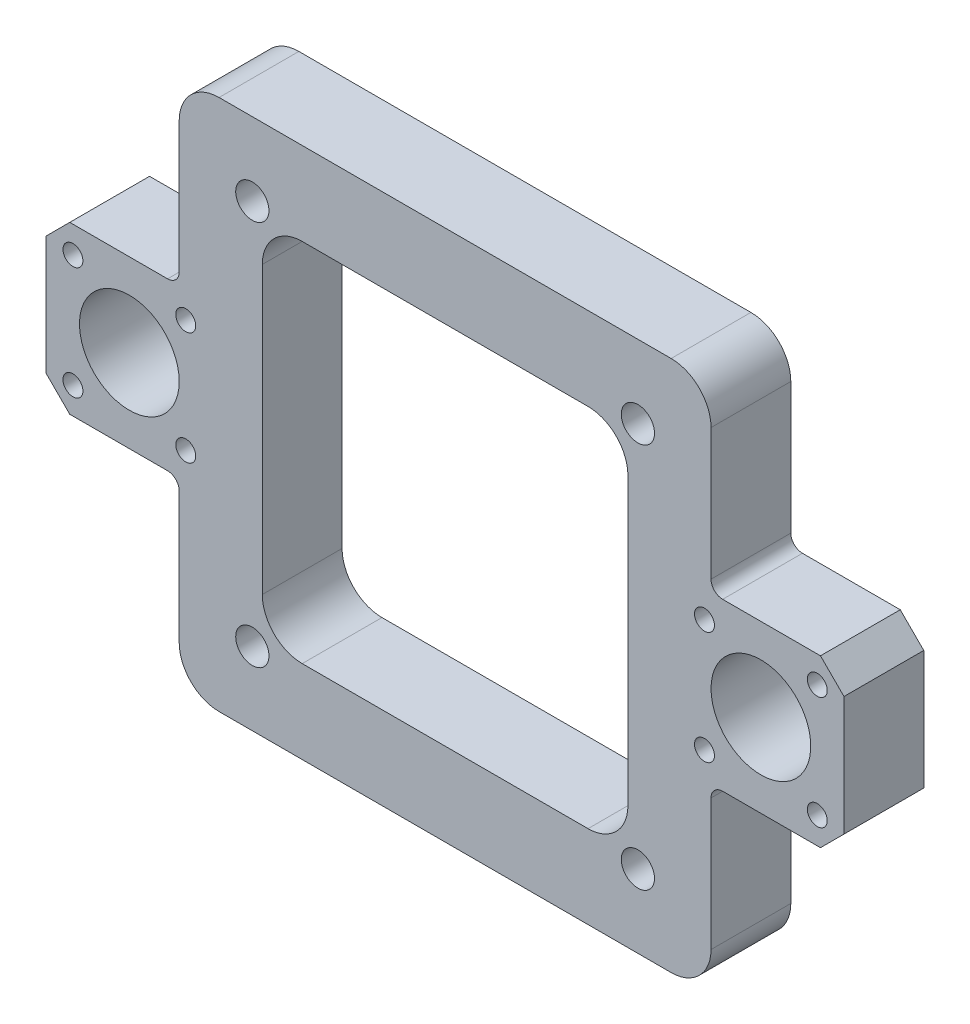
from build123d import *

# Parameters (mm, degrees)
SKETCH1_R               = 7.5
SKETCH1_R_2             = 1.5
SKETCH1_R_3             = 2.5
BOSS_EXTRUDE1_DEPTH     = 12
CUT_EXTRUDE1_DEPTH      = 74.10266753
CUT_EXTRUDE1_DEPTH_BACK = 74.10266753


with BuildPart() as part:
    # Sketch1 → Boss-Extrude1 (new body)
    with BuildSketch(Plane.XY):
        with BuildLine():
            Line((-56.464466094, 12.5), (-41.75, 12.5))
            ThreePointArc((-41.75, 12.5), (-40.512563133, 13.012563133), (-40, 14.25))
            Line((-40, 14.25), (-40, 34))
            ThreePointArc((-40, 34), (-38.242640687, 38.242640687), (-34, 40))
            Line((-34, 40), (34, 40))
            ThreePointArc((34, 40), (38.242640687, 38.242640687), (40, 34))
            Line((40, 34), (40, 14.25))
            ThreePointArc((40, 14.25), (40.512563133, 13.012563133), (41.75, 12.5))
            Line((41.75, 12.5), (56.464466094, 12.5))
            Line((56.464466094, 12.5), (60, 8.964466094))
            Line((60, 8.964466094), (60, -8.964466094))
            Line((60, -8.964466094), (56.464466094, -12.5))
            Line((56.464466094, -12.5), (41.75, -12.5))
            ThreePointArc((41.75, -12.5), (40.512563133, -13.012563133), (40, -14.25))
            Line((40, -14.25), (40, -34))
            ThreePointArc((40, -34), (38.242640687, -38.242640687), (34, -40))
            Line((34, -40), (-34, -40))
            ThreePointArc((-34, -40), (-38.242640687, -38.242640687), (-40, -34))
            Line((-40, -34), (-40, -14.25))
            ThreePointArc((-40, -14.25), (-40.512563133, -13.012563133), (-41.75, -12.5))
            Line((-41.75, -12.5), (-56.464466094, -12.5))
            Line((-56.464466094, -12.5), (-60, -8.964466094))
            Line((-60, -8.964466094), (-60, 8.964466094))
            Line((-60, 8.964466094), (-56.464466094, 12.5))
        make_face()
        with Locations((-47.5, 0)):
            Circle(SKETCH1_R, mode=Mode.SUBTRACT)
        with Locations((47.5, 0)):
            Circle(SKETCH1_R, mode=Mode.SUBTRACT)
        with Locations((-55.985281374, 8.485281374)):
            Circle(SKETCH1_R_2, mode=Mode.SUBTRACT)
        with Locations((-39.014718626, -8.485281374)):
            Circle(SKETCH1_R_2, mode=Mode.SUBTRACT)
        with Locations((-39.014718626, 8.485281374)):
            Circle(SKETCH1_R_2, mode=Mode.SUBTRACT)
        with Locations((-55.985281374, -8.485281374)):
            Circle(SKETCH1_R_2, mode=Mode.SUBTRACT)
        with Locations((39.014718626, -8.485281374)):
            Circle(SKETCH1_R_2, mode=Mode.SUBTRACT)
        with Locations((55.985281374, -8.485281374)):
            Circle(SKETCH1_R_2, mode=Mode.SUBTRACT)
        with Locations((55.985281374, 8.485281374)):
            Circle(SKETCH1_R_2, mode=Mode.SUBTRACT)
        with Locations((39.014718626, 8.485281374)):
            Circle(SKETCH1_R_2, mode=Mode.SUBTRACT)
        with Locations((-29, 29)):
            Circle(SKETCH1_R_3, mode=Mode.SUBTRACT)
        with Locations((29, 29)):
            Circle(SKETCH1_R_3, mode=Mode.SUBTRACT)
        with Locations((29, -29)):
            Circle(SKETCH1_R_3, mode=Mode.SUBTRACT)
        with Locations((-29, -29)):
            Circle(SKETCH1_R_3, mode=Mode.SUBTRACT)
    extrude(amount=BOSS_EXTRUDE1_DEPTH)

    # Sketch2 → Cut-Extrude1 (cut, two sides: drawn at the far end of the back side and taken through both)
    with BuildSketch(Plane.XY.offset(12).offset(-CUT_EXTRUDE1_DEPTH_BACK)):
        with BuildLine():
            Line((-21.5, 27.5), (21.5, 27.5))
            ThreePointArc((21.5, 27.5), (25.742640687, 25.742640687), (27.5, 21.5))
            Line((27.5, 21.5), (27.5, -21.5))
            ThreePointArc((27.5, -21.5), (25.742640687, -25.742640687), (21.5, -27.5))
            Line((21.5, -27.5), (-21.5, -27.5))
            ThreePointArc((-21.5, -27.5), (-25.742640687, -25.742640687), (-27.5, -21.5))
            Line((-27.5, -21.5), (-27.5, 21.5))
            ThreePointArc((-27.5, 21.5), (-25.742640687, 25.742640687), (-21.5, 27.5))
        make_face()
    extrude(amount=CUT_EXTRUDE1_DEPTH + CUT_EXTRUDE1_DEPTH_BACK, mode=Mode.SUBTRACT)


solid = part.part
